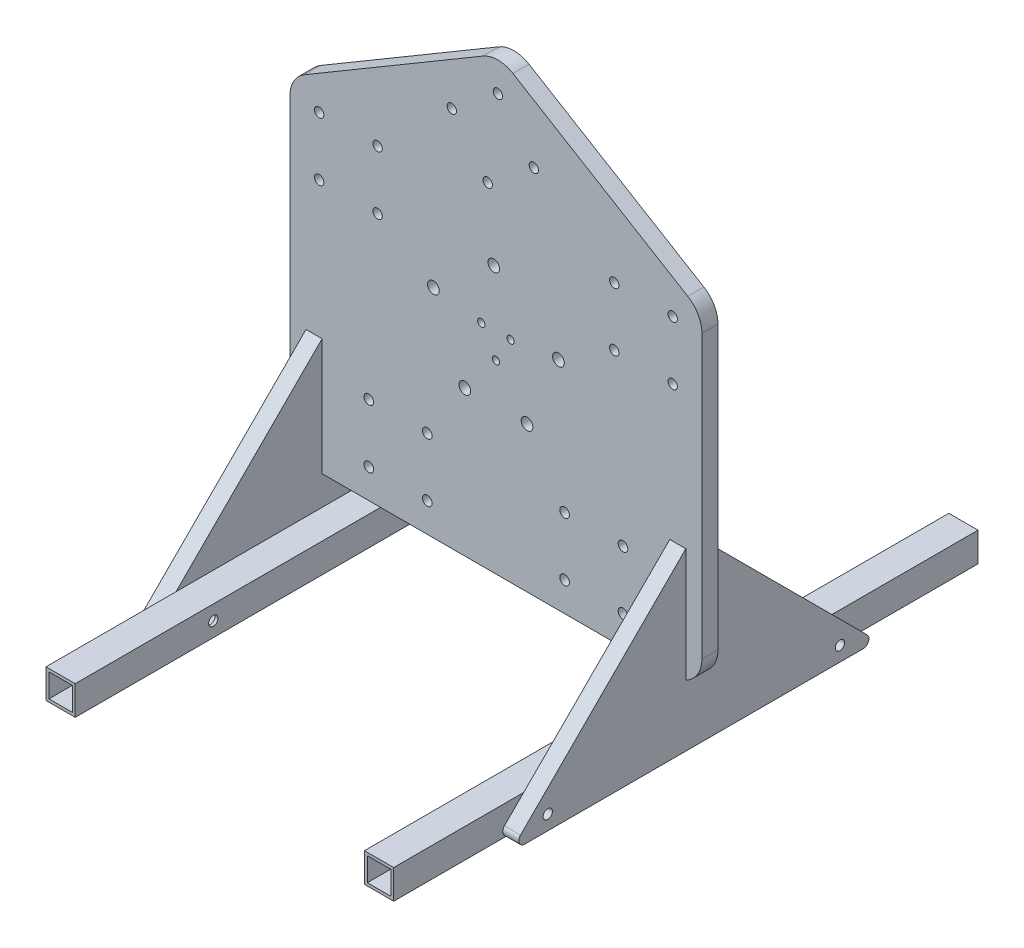
from build123d import *

# Parameters (mm, degrees)
SKETCH_2_R           = 1.65
SKETCH_2_R_2         = 1.6
SKETCH_2_R_3         = 2
SKETCH_2_R_4         = 1.25
EXTRUDE_1_DEPTH      = 5.5
SKETCH_4_R           = 27
SKETCH_4_R_2         = 1.7
SKETCH_4_R_3         = 1.6
EXTRUDE_2_DEPTH      = 10
SKETCH_6_W           = 5.5
SKETCH_6_H           = 20
CUT_EXTRUDE_1_DEPTH  = 120.883998573
EXTRUDE_3_DEPTH      = 5.5
FILLET_1_R           = 2
EXTRUDE_4_DEPTH      = 100
EXTRUDE_4_DEPTH_BACK = 100
SKETCH_8_W           = 10
SKETCH_8_H           = 10
SKETCH_8_W_2         = 8
SKETCH_8_H_2         = 8
SKETCH_9_R           = 1.6
CUT_EXTRUDE_2_DEPTH  = 194.705764276


with BuildPart() as part:
    # ｽｹｯﾁ2 → ﾎﾞｽ - 押し出し1 (new body)
    with BuildSketch(Plane.XY):
        with BuildLine():
            Line((-70.5, 49.593386622), (-70.5, -47))
            ThreePointArc((-70.5, -47), (-67.571067812, -54.071067812), (-60.5, -57))
            Line((-60.5, -57), (60.5, -57))
            ThreePointArc((60.5, -57), (67.571067812, -54.071067812), (70.5, -47))
            Line((70.5, -47), (70.5, 49.593386622))
            ThreePointArc((70.5, 49.593386622), (69.20875528, 54.508422887), (65.668483704, 58.154156226))
            Line((65.668483704, 58.154156226), (5.836088923, 94.277398847))
            ThreePointArc((5.836088923, 94.277398847), (0.716178639, 95.716511274), (-4.417470407, 94.327204479))
            Line((-4.417470407, 94.327204479), (-65.585075625, 58.203961858))
            ThreePointArc((-65.585075625, 58.203961858), (-69.184778531, 54.550666307), (-70.5, 49.593386622))
        make_face()
        with Locations((-43.5, -47)):
            Circle(SKETCH_2_R, mode=Mode.SUBTRACT)
        with Locations((-43.5, -27)):
            Circle(SKETCH_2_R, mode=Mode.SUBTRACT)
        with Locations((-23.5, -27)):
            Circle(SKETCH_2_R, mode=Mode.SUBTRACT)
        with Locations((-23.5, -47)):
            Circle(SKETCH_2_R, mode=Mode.SUBTRACT)
        with Locations((23.5, -47)):
            Circle(SKETCH_2_R, mode=Mode.SUBTRACT)
        with Locations((23.5, -27)):
            Circle(SKETCH_2_R, mode=Mode.SUBTRACT)
        with Locations((43.5, -27)):
            Circle(SKETCH_2_R, mode=Mode.SUBTRACT)
        with Locations((43.5, -47)):
            Circle(SKETCH_2_R, mode=Mode.SUBTRACT)
        with Locations((-60.5, 49.593386622)):
            Circle(SKETCH_2_R_2, mode=Mode.SUBTRACT)
        with Locations((-60.5, 29.593386622)):
            Circle(SKETCH_2_R_2, mode=Mode.SUBTRACT)
        with Locations((-40.5, 29.593386622)):
            Circle(SKETCH_2_R_2, mode=Mode.SUBTRACT)
        with Locations((-40.5, 49.593386622)):
            Circle(SKETCH_2_R_2, mode=Mode.SUBTRACT)
        with Locations((40.5, 49.593386622)):
            Circle(SKETCH_2_R_2, mode=Mode.SUBTRACT)
        with Locations((40.5, 29.593386622)):
            Circle(SKETCH_2_R_2, mode=Mode.SUBTRACT)
        with Locations((60.5, 29.593386622)):
            Circle(SKETCH_2_R_2, mode=Mode.SUBTRACT)
        with Locations((60.5, 49.593386622)):
            Circle(SKETCH_2_R_2, mode=Mode.SUBTRACT)
        with Locations((0.667605219, 85.716629244)):
            Circle(SKETCH_2_R_2, mode=Mode.SUBTRACT)
        with Locations((-15.103517658, 73.41737385)):
            Circle(SKETCH_2_R_2, mode=Mode.SUBTRACT)
        with Locations((-2.804262264, 57.646250974)):
            Circle(SKETCH_2_R_2, mode=Mode.SUBTRACT)
        with Locations((12.966860612, 69.945506367)):
            Circle(SKETCH_2_R_2, mode=Mode.SUBTRACT)
        with Locations((-21.396395224, 17.211420564)):
            Circle(SKETCH_2_R_3, mode=Mode.SUBTRACT)
        with Locations((-0.742556954, 34.080851442)):
            Circle(SKETCH_2_R_3, mode=Mode.SUBTRACT)
        with Locations((21.396395224, 17.211420564)):
            Circle(SKETCH_2_R_3, mode=Mode.SUBTRACT)
        with Locations((10.641753687, -7.161562831)):
            Circle(SKETCH_2_R_3, mode=Mode.SUBTRACT)
        with Locations((-10.641753687, -7.161562831)):
            Circle(SKETCH_2_R_3, mode=Mode.SUBTRACT)
        with Locations((0, 6.319883931)):
            Circle(SKETCH_2_R_4, mode=Mode.SUBTRACT)
        with Locations((-5, 14.980137968)):
            Circle(SKETCH_2_R_4, mode=Mode.SUBTRACT)
        with Locations((5, 14.980137968)):
            Circle(SKETCH_2_R_4, mode=Mode.SUBTRACT)
    extrude(amount=EXTRUDE_1_DEPTH)

    # ｽｹｯﾁ6 → ｶｯﾄ - 押し出し1 (cut, through all)
    with BuildSketch(Plane.XY.offset(5.5)):
        with Locations((62.25, -47)):
            Rectangle(SKETCH_6_W, SKETCH_6_H)
        with Locations((-62.25, -47)):
            Rectangle(SKETCH_6_W, SKETCH_6_H)
    extrude(amount=-CUT_EXTRUDE_1_DEPTH, mode=Mode.SUBTRACT)


with BuildPart() as body_2:
    # ｽｹｯﾁ4 → ﾎﾞｽ - 押し出し2 (new body)
    with BuildSketch(Plane(origin=(0, 0, 0), x_dir=(-1, 0, 0), z_dir=(0, 0, -1))):
        with Locations((0, 12.093386622)):
            Circle(SKETCH_4_R)
        with Locations((0.742556954, 34.080851442)):
            Circle(SKETCH_4_R_2, mode=Mode.SUBTRACT)
        with Locations((-21.396395224, 17.211420564)):
            Circle(SKETCH_4_R_2, mode=Mode.SUBTRACT)
        with Locations((21.396395224, 17.211420564)):
            Circle(SKETCH_4_R_2, mode=Mode.SUBTRACT)
        with Locations((10.641753687, -7.161562831)):
            Circle(SKETCH_4_R_2, mode=Mode.SUBTRACT)
        with Locations((-10.641753687, -7.161562831)):
            Circle(SKETCH_4_R_2, mode=Mode.SUBTRACT)
        with Locations((0, 6.319883931)):
            Circle(SKETCH_4_R_3, mode=Mode.SUBTRACT)
        with Locations((-5, 14.980137968)):
            Circle(SKETCH_4_R_3, mode=Mode.SUBTRACT)
        with Locations((5, 14.980137968)):
            Circle(SKETCH_4_R_3, mode=Mode.SUBTRACT)
    extrude(amount=EXTRUDE_2_DEPTH)


with BuildPart() as body_3:
    # ｽｹｯﾁ7 → ﾎﾞｽ - 押し出し3 (new body)
    with BuildSketch(Plane.ZY.offset(-65)):
        Polygon((0, -37), (5.5, -37), (5.5, -17), (65.5, -77), (-60, -77), (0, -17), align=None)
    extrude(amount=EXTRUDE_3_DEPTH)

    # ﾌｨﾚｯﾄ1
    fillet_1_edges = [body_3.edges().sort_by_distance(p)[0] for p in [
        (62.25, -77, -60),
        (62.25, -77, 65.5),
    ]]
    fillet(fillet_1_edges, radius=FILLET_1_R)


with BuildPart() as body_4:
    # ﾐﾗｰ1: mirrored copy
    add(body_3.part.mirror(Plane(origin=(0, 0, 0), x_dir=(0, 0, 1), z_dir=(1, 0, 0))))


with BuildPart() as body_5:
    # ｽｹｯﾁ8 → ﾎﾞｽ - 押し出し4 (new, two sides: drawn at the far end of the back side and taken through both)
    with BuildSketch(Plane.XY.offset(-EXTRUDE_4_DEPTH_BACK)):
        with Locations((-54.5, -72)):
            Rectangle(SKETCH_8_W, SKETCH_8_H)
        with Locations((-54.5, -72)):
            Rectangle(SKETCH_8_W_2, SKETCH_8_H_2, mode=Mode.SUBTRACT)
    extrude(amount=EXTRUDE_4_DEPTH + EXTRUDE_4_DEPTH_BACK)


with BuildPart() as body_6:
    # ﾐﾗｰ2: mirrored copy
    add(body_5.part.mirror(Plane(origin=(0, 0, 0), x_dir=(0, 0, 1), z_dir=(1, 0, 0))))


with BuildPart() as cut_extrude_2_tool:
    # ｽｹｯﾁ9 → ｶｯﾄ - 押し出し2 (new, through all)
    with BuildSketch(Plane(origin=(65, 0, 0), x_dir=(0, 0, -1), z_dir=(1, 0, 0))):
        with Locations((47.25, -72)):
            Circle(SKETCH_9_R)
        with Locations((-52.75, -72)):
            Circle(SKETCH_9_R)
    extrude(amount=-CUT_EXTRUDE_2_DEPTH)


with BuildPart() as body_3_1:
    add(body_3.part)

    # ｶｯﾄ - 押し出し2: cut by cut_extrude_2_tool
    add(cut_extrude_2_tool.part, mode=Mode.SUBTRACT)


with BuildPart() as body_4_1:
    add(body_4.part)

    # ｶｯﾄ - 押し出し2: cut by cut_extrude_2_tool
    add(cut_extrude_2_tool.part, mode=Mode.SUBTRACT)


with BuildPart() as body_5_1:
    add(body_5.part)

    # ｶｯﾄ - 押し出し2: cut by cut_extrude_2_tool
    add(cut_extrude_2_tool.part, mode=Mode.SUBTRACT)


with BuildPart() as body_6_1:
    add(body_6.part)

    # ｶｯﾄ - 押し出し2: cut by cut_extrude_2_tool
    add(cut_extrude_2_tool.part, mode=Mode.SUBTRACT)


solid = Compound([part.part, body_2.part, body_3_1.part, body_4_1.part, body_5_1.part, body_6_1.part])
